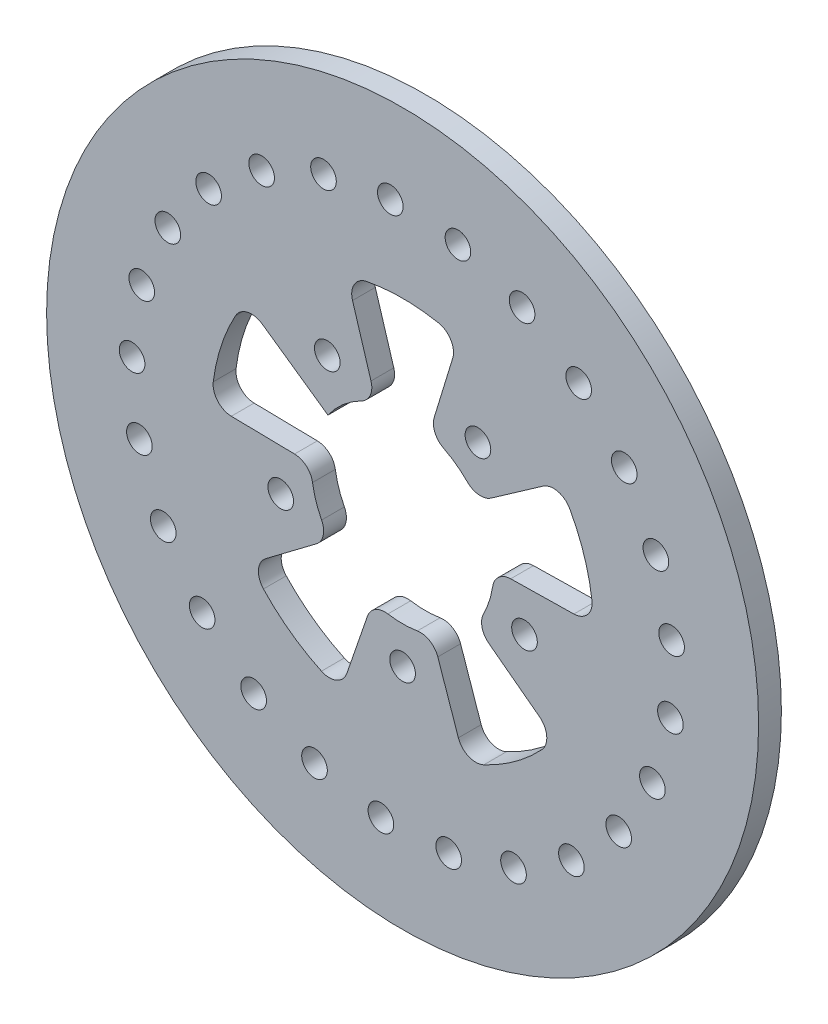
from build123d import *

# Parameters (mm, degrees)
SKETCH5_R               = 125
SKETCH5_R_2             = 32
BOSS_EXTRUDE2_DEPTH     = 4
CUT_EXTRUDE1_REACH      = 178.958
SKETCH7_R               = 4.5
CIRPATTERN1_COUNT       = 5
FILL_START              = -4
FILL_PATTERN1_OUTLINE_R = 4.5
FILL_PATTERN1_DEPTH     = 8
FILLET1_R               = 6.5


# Read off the part's stored shape, not the designer's step: Fill Pattern1
with BuildPart() as part:
    # Sketch5 → Boss-Extrude2 (new, symmetric)
    with BuildSketch(Plane.XY):
        Circle(SKETCH5_R)
        Circle(SKETCH5_R_2, mode=Mode.SUBTRACT)
    extrude(amount=BOSS_EXTRUDE2_DEPTH, both=True)

    # Sketch7 → Cut-Extrude1 (cut, up to next)
    with BuildSketch(Plane.XY.offset(4), mode=Mode.PRIVATE) as cut_extrude1_sk1:
        with BuildLine():
            ThreePointArc((-9.355894551, 30.601752191), (0, 32), (9.355894551, 30.601752191))
            Line((9.355894551, 30.601752191), (19.588904216, 64.07241865))
            ThreePointArc((19.588904216, 64.07241865), (0, 67), (-19.588904216, 64.07241865))
            Line((-19.588904216, 64.07241865), (-9.355894551, 30.601752191))
        make_face()
    cut_extrude1_tool1 = extrude(cut_extrude1_sk1.sketch, amount=-CUT_EXTRUDE1_REACH, mode=Mode.PRIVATE) & part.part
    # Sketch7 → Cut-Extrude1 (cut, up to next)
    with BuildSketch(Plane.XY.offset(4), mode=Mode.PRIVATE) as cut_extrude1_sk2:
        with Locations((-26.450336353, 36.405764747)):
            Circle(SKETCH7_R)
    cut_extrude1_tool2 = extrude(cut_extrude1_sk2.sketch, amount=-CUT_EXTRUDE1_REACH, mode=Mode.PRIVATE) & part.part
    cut_extrude1_1 = cut_extrude1_tool1.solids().sort_by_distance((0, 50.80907, 4))[0]
    add(cut_extrude1_1, mode=Mode.SUBTRACT)
    cut_extrude1_2 = cut_extrude1_tool2.solids().sort_by_distance((-26.450336, 36.405765, 4))[0]
    add(cut_extrude1_2, mode=Mode.SUBTRACT)
    cut_extrude1 = cut_extrude1_1 + cut_extrude1_2  # Cut-Extrude1 as one shape, for the pattern or mirror that repeats it

    # CirPattern1: Cut-Extrude1 ×5 about axis
    cirpattern1_axis = Axis((0, 0, 0), (0, 0, 1))
    for i in range(1, CIRPATTERN1_COUNT):
        add(cut_extrude1.rotate(cirpattern1_axis, i * 360 / CIRPATTERN1_COUNT), mode=Mode.SUBTRACT)

    # Fill Pattern1 outline → Fill Pattern1 (cut)
    with BuildSketch(Plane.XY.offset(FILL_START)):
        with Locations((-94.985534108, 1.657978305)):
            Circle(FILL_PATTERN1_OUTLINE_R)
        with Locations((-92.413711498, -22.016051139)):
            Circle(FILL_PATTERN1_OUTLINE_R)
        with Locations((-84.035195714, -44.306731139)):
            Circle(FILL_PATTERN1_OUTLINE_R)
        with Locations((-70.376439715, -63.813456292)):
            Circle(FILL_PATTERN1_OUTLINE_R)
        with Locations((-52.295673376, -79.310547317)):
            Circle(FILL_PATTERN1_OUTLINE_R)
        with Locations((-30.928977742, -89.824264989)):
            Circle(FILL_PATTERN1_OUTLINE_R)
        with Locations((-7.618900879, -94.69399376)):
            Circle(FILL_PATTERN1_OUTLINE_R)
        with Locations((16.169899353, -93.613750663)):
            Circle(FILL_PATTERN1_OUTLINE_R)
        with Locations((38.942685147, -86.651411343)):
            Circle(FILL_PATTERN1_OUTLINE_R)
        with Locations((59.268558619, -74.244445187)):
            Circle(FILL_PATTERN1_OUTLINE_R)
        with Locations((75.870370386, -57.172427506)):
            Circle(FILL_PATTERN1_OUTLINE_R)
        with Locations((87.704967558, -36.508055959)):
            Circle(FILL_PATTERN1_OUTLINE_R)
        with Locations((94.028738868, -13.549749009)):
            Circle(FILL_PATTERN1_OUTLINE_R)
        with Locations((94.444338509, 10.259938485)):
            Circle(FILL_PATTERN1_OUTLINE_R)
        with Locations((88.925652827, 33.424956292)):
            Circle(FILL_PATTERN1_OUTLINE_R)
        with Locations((77.819441139, 54.489761147)):
            Circle(FILL_PATTERN1_OUTLINE_R)
        with Locations((61.823547572, 72.13077389)):
            Circle(FILL_PATTERN1_OUTLINE_R)
        with Locations((41.943052947, 85.239544812)):
            Circle(FILL_PATTERN1_OUTLINE_R)
        with Locations((19.427121857, 92.992401626)):
            Circle(FILL_PATTERN1_OUTLINE_R)
        with Locations((-4.30948694, 94.902203823)):
            Circle(FILL_PATTERN1_OUTLINE_R)
        with Locations((-27.775315017, 90.84895151)):
            Circle(FILL_PATTERN1_OUTLINE_R)
        with Locations((-49.495918093, 81.087325434)):
            Circle(FILL_PATTERN1_OUTLINE_R)
        with Locations((-68.106510795, 66.230684464)):
            Circle(FILL_PATTERN1_OUTLINE_R)
        with Locations((-82.437721138, 47.212525991)):
            Circle(FILL_PATTERN1_OUTLINE_R)
        with Locations((-91.58906647, 25.227830854)):
            Circle(FILL_PATTERN1_OUTLINE_R)
    extrude(amount=FILL_PATTERN1_DEPTH, mode=Mode.SUBTRACT)

    # Fillet1
    fillet1_edges = [part.edges().sort_by_distance(p)[0] for p in [
        (19.588904216, 64.07241865, 0),
        (9.355894551, 30.601752191, 0),
        (-9.355894551, 30.601752191, 0),
        (-19.588904216, 64.07241865, 0),
        (-53.508579173, -40.321606551, 0),
        (-25.556336322, -19.258080741, 0),
        (-10.418180943, -30.256594419, 0),
        (-21.813066349, -63.349744565, 0),
        (21.813066349, -63.349744565, 0),
        (10.418180943, -30.256594419, 0),
        (25.556336322, -19.258080741, 0),
        (53.508579173, -40.321606551, 0),
        (66.989795575, 1.169311231, 0),
        (31.995126245, 0.558477006, 0),
        (26.212865417, 18.354445963, 0),
        (54.883186967, 38.429621236, 0),
        (-54.883186967, 38.429621236, 0),
        (-31.995126245, 0.558477006, 0),
        (-66.989795575, 1.169311231, 0),
    ]]
    fillet(fillet1_edges, radius=FILLET1_R)


solid = part.part
